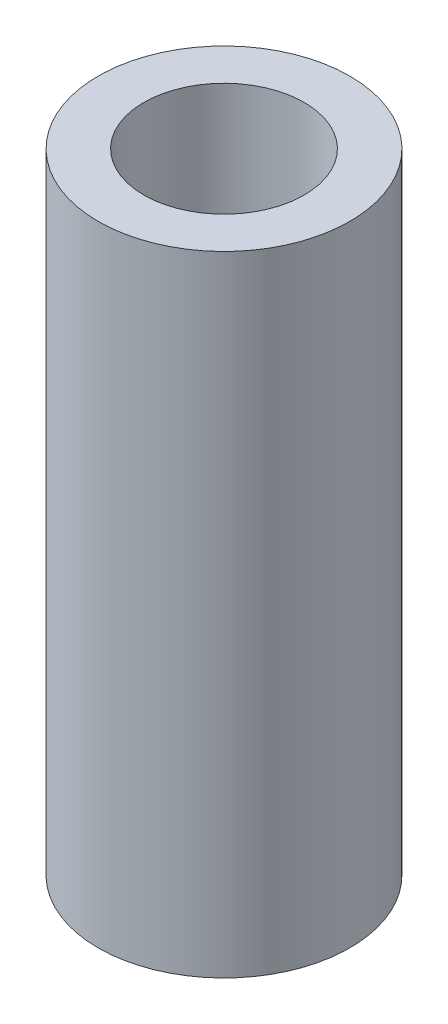
from build123d import *

# Parameters (mm, degrees)
SKETCH_1_R      = 4
SKETCH_1_R_2    = 2.55
EXTRUDE_1_DEPTH = 20


with BuildPart() as part:
    # 草图1 → 凸台-拉伸1 (new body)
    with BuildSketch(Plane(origin=(0, 0, 0), x_dir=(1, 0, 0), z_dir=(0, 1, 0))):
        Circle(SKETCH_1_R)
        Circle(SKETCH_1_R_2, mode=Mode.SUBTRACT)
    extrude(amount=EXTRUDE_1_DEPTH)


solid = part.part
